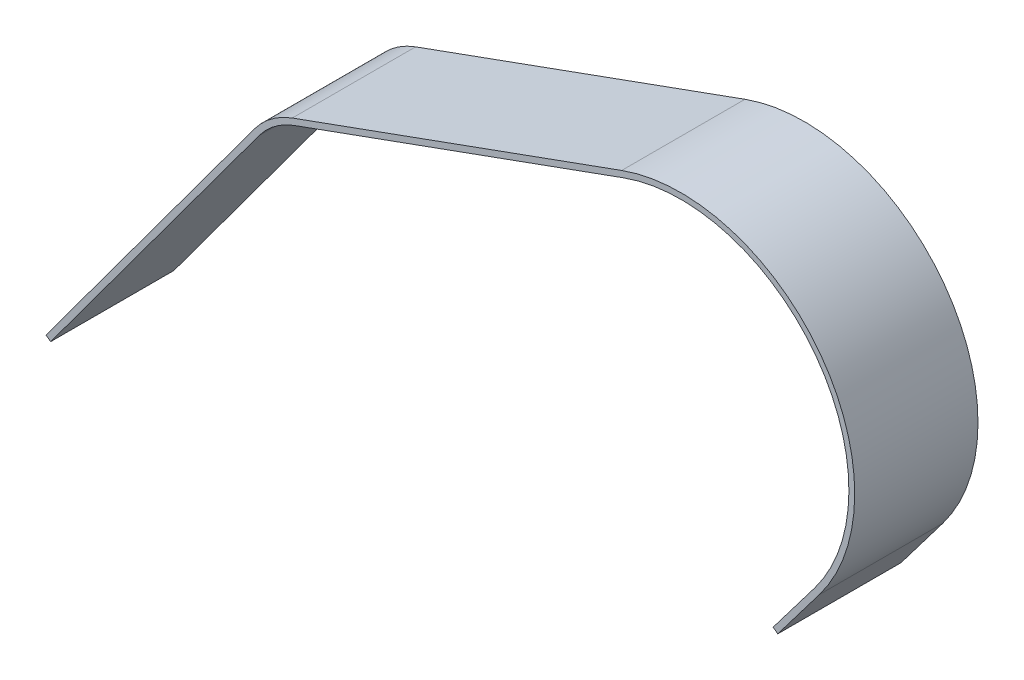
from build123d import *

# Parameters (mm, degrees)
EXTRUDE_THIN1_DEPTH = 67.564


with BuildPart() as part:
    # Sketch1 → Extrude-Thin1 (new body)
    with BuildSketch(Plane.XY):
        with BuildLine():
            Line((-171.530725158, -169.540176263), (-57.207776809, -14.493356815))
            ThreePointArc((-57.207776809, -14.493356815), (-48.029088686, -5.258412911), (-36.568222458, 0.920668726))
            Line((-36.568222458, 0.920668726), (143.952557391, 66.301099815))
            ThreePointArc((143.952557391, 66.301099815), (253.095507904, 33.210999285), (252.264699452, -80.834816757))
            Line((252.264699452, -80.834816757), (229.469051384, -110.874685447))
            Line((229.469051384, -110.874685447), (226.93983158, -108.955395947))
            Line((226.93983158, -108.955395947), (249.735479648, -78.915527258))
            ThreePointArc((249.735479648, -78.915527258), (250.538594484, 31.328761583), (145.033742323, 63.315858762))
            Line((145.033742323, 63.315858762), (-35.487037526, -2.064572327))
            ThreePointArc((-35.487037526, -2.064572327), (-46.129270453, -7.80229099), (-54.652337995, -16.377596044))
            Line((-54.652337995, -16.377596044), (-168.975286345, -171.424415492))
            Line((-168.975286345, -171.424415492), (-171.530725158, -169.540176263))
        make_face()
    extrude(amount=EXTRUDE_THIN1_DEPTH)


solid = part.part
